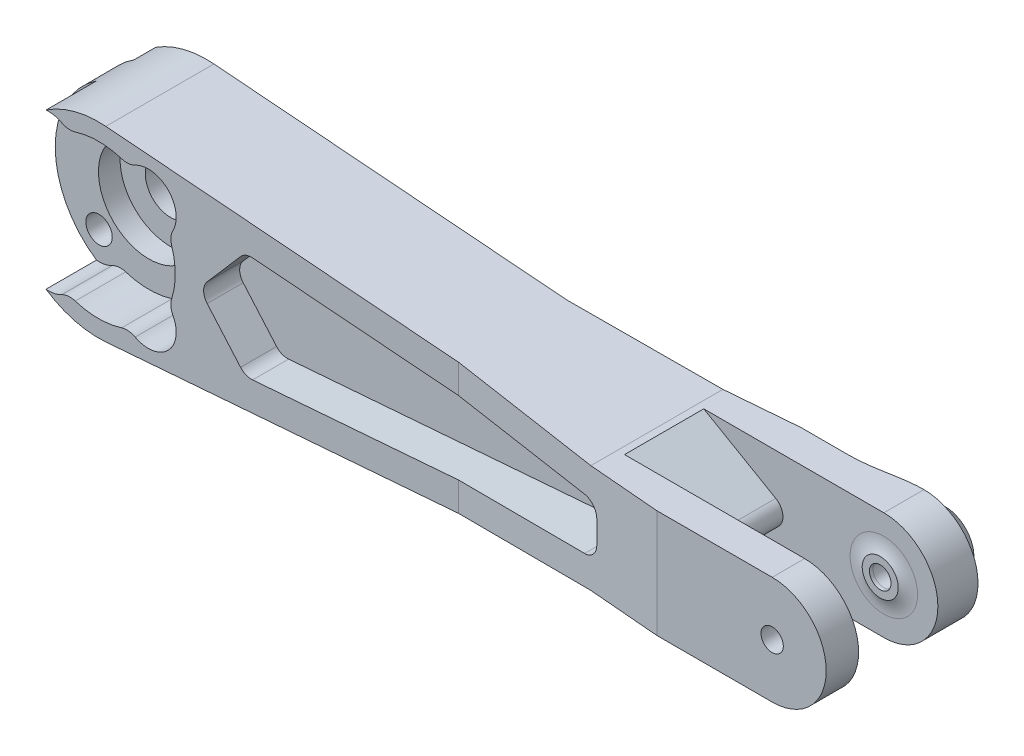
from build123d import *

# Parameters (mm, degrees)
SKETCH2_R               = 13
SKETCH2_R_2             = 7.5
BOSS_EXTRUDE2_DEPTH     = 10
CUT_EXTRUDE1_DEPTH      = 105.791459576
CUT_EXTRUDE1_DEPTH_BACK = 105.791459576
SKETCH5_R               = 1.83
SKETCH5_R_2             = 3.5
CUT_EXTRUDE2_DEPTH      = 106.770979007
HUB_CUTOUT_DEPTH        = 7
SKETCH8_R               = 7
CUT_EXTRUDE4_DEPTH      = 3
CUT_EXTRUDE5_DEPTH      = 105.791459576
CUT_EXTRUDE5_DEPTH_BACK = 105.791459576
SKETCH9_R               = 1.55
CUT_EXTRUDE6_DEPTH      = 5.5
FILLET1_R               = 2
CUT_EXTRUDE7_START      = 2.5
CUT_EXTRUDE7_DEPTH      = 103.291459576
FILLET2_R               = 2
FILLET2_OF_MIRROR1_R    = 2
SKETCH12_R              = 4
SKETCH12_R_2            = 1.55
BOSS_EXTRUDE3_DEPTH     = 4
FILLET3_START           = -14
FILLET3_2_DEPTH         = 4
BOSS_EXTRUDE4_START     = 5.5
SKETCH13_R              = 2.5
SKETCH13_R_2            = 1.5
BOSS_EXTRUDE4_DEPTH     = 0.5
BOSS_EXTRUDE5_START     = -5
SKETCH13_2_R            = 2.5
SKETCH13_2_R_2          = 1.5
BOSS_EXTRUDE5_DEPTH     = 0.5
FILLET4_R               = 5
SKETCH15_R              = 4
CUT_EXTRUDE8_DEPTH      = 3


with BuildPart() as part:
    # Sketch2 → Boss-Extrude2 (new, symmetric)
    with BuildSketch(Plane.XY):
        Circle(SKETCH2_R)
        with BuildLine():
            Line((70, 7.5), (1.025771359, 12.959467316))
            ThreePointArc((1.025771359, 12.959467316), (9.548168088, 8.822272166), (13, 0))
            ThreePointArc((13, 0), (9.548168088, -8.822272166), (1.025771359, -12.959467316))
            Line((1.025771359, -12.959467316), (70, -7.5))
            Line((70, -7.5), (70, 7.5))
        make_face()
        with BuildLine():
            Line((96, 7.5), (70, 7.5))
            Line((70, 7.5), (70, -7.5))
            Line((70, -7.5), (96, -7.5))
            ThreePointArc((96, -7.5), (88.5, 0), (96, 7.5))
        make_face()
        with Locations((96, 0)):
            Circle(SKETCH2_R_2)
        Circle(SKETCH2_R)
    extrude(amount=BOSS_EXTRUDE2_DEPTH, both=True)

    # Sketch4 → Cut-Extrude1 (cut, two sides: drawn at the far end of the back side and taken through both)
    with BuildSketch(Plane(origin=(0, 0, 0), x_dir=(1, 0, 0), z_dir=(0, 1, 0)).offset(-CUT_EXTRUDE1_DEPTH_BACK)):
        Polygon((-13, 7.5), (50, 7.5), (80, 10), (-13, 10), align=None)
        Polygon((-13, -7.5), (50, -7.5), (80, -10), (-13, -10), align=None)
    extrude(amount=CUT_EXTRUDE1_DEPTH + CUT_EXTRUDE1_DEPTH_BACK, mode=Mode.SUBTRACT)

    # Sketch5 → Cut-Extrude2 (cut, through all)
    with BuildSketch(Plane.XY.offset(7.5)):
        with Locations((-6.914797213, 6.914797213)):
            Circle(SKETCH5_R)
        with Locations((6.914797213, 6.914797213)):
            Circle(SKETCH5_R)
        with Locations((6.914797213, -6.914797213)):
            Circle(SKETCH5_R)
        with Locations((-6.914797213, -6.914797213)):
            Circle(SKETCH5_R)
        Circle(SKETCH5_R_2)
    extrude(amount=-CUT_EXTRUDE2_DEPTH, mode=Mode.SUBTRACT)

    # Sketch7 → hub cutout (cut)
    with BuildSketch(Plane.XY.offset(7.5)):
        with BuildLine():
            ThreePointArc((-7.281143007, 10.769631215), (-13, 0), (-7.281143007, -10.769631215))
            ThreePointArc((-7.281143007, -10.769631215), (-6.15529138, -10.711783559), (-5.093815501, -10.332103173))
            ThreePointArc((-5.093815501, -10.332103173), (-4.17580433, -10.057753531), (-3.223255475, -10.161014917))
            ThreePointArc((-3.223255475, -10.161014917), (0, -10.66), (3.223255475, -10.161014917))
            ThreePointArc((3.223255475, -10.161014917), (4.17580433, -10.057753531), (5.093815501, -10.332103173))
            ThreePointArc((5.093815501, -10.332103173), (9.652858062, -9.652858062), (10.332103173, -5.093815501))
            ThreePointArc((10.332103173, -5.093815501), (10.057753531, -4.17580433), (10.161014917, -3.223255475))
            ThreePointArc((10.161014917, -3.223255475), (10.66, 0), (10.161014917, 3.223255475))
            ThreePointArc((10.161014917, 3.223255475), (10.057753531, 4.17580433), (10.332103173, 5.093815501))
            ThreePointArc((10.332103173, 5.093815501), (9.652858062, 9.652858062), (5.093815501, 10.332103173))
            ThreePointArc((5.093815501, 10.332103173), (4.17580433, 10.057753531), (3.223255475, 10.161014917))
            ThreePointArc((3.223255475, 10.161014917), (0, 10.66), (-3.223255475, 10.161014917))
            ThreePointArc((-3.223255475, 10.161014917), (-4.17580433, 10.057753531), (-5.093815501, 10.332103173))
            ThreePointArc((-5.093815501, 10.332103173), (-6.15529138, 10.711783559), (-7.281143007, 10.769631215))
        make_face()
    extrude(amount=-HUB_CUTOUT_DEPTH, mode=Mode.SUBTRACT)

    # Sketch8 → Cut-Extrude4 (cut)
    with BuildSketch(Plane.XY.offset(0.5)):
        Circle(SKETCH8_R)
    extrude(amount=-CUT_EXTRUDE4_DEPTH, mode=Mode.SUBTRACT)

    # Sketch9 → Cut-Extrude5 (cut, two sides: drawn at the far end of the back side and taken through both)
    with BuildSketch(Plane.XY.offset(-CUT_EXTRUDE5_DEPTH_BACK)):
        with Locations((96, 0)):
            Circle(SKETCH9_R)
    extrude(amount=CUT_EXTRUDE5_DEPTH + CUT_EXTRUDE5_DEPTH_BACK, mode=Mode.SUBTRACT)

    # Sketch10 → Cut-Extrude6 (cut, symmetric)
    with BuildSketch(Plane.XY):
        Polygon((84, 0), (62.184725581, 12.595054558), (110.068063566, 12.595054558), (110.068063566, -12.520209035), (62.31436183, -12.520209035), align=None)
    extrude(amount=CUT_EXTRUDE6_DEPTH, both=True, mode=Mode.SUBTRACT)

    # Fillet1
    fillet1_edges = [part.edges().sort_by_distance(p)[0] for p in [
        (84, 0, 0),
    ]]
    fillet(fillet1_edges, radius=FILLET1_R)

    # Sketch11 → Cut-Extrude7 (cut, through all)
    with BuildSketch(Plane.XY.offset(CUT_EXTRUDE7_START)):
        Polygon((13.951045221, 0), (20.381756661, 7.414886386), (70.904413477, 3.415903011), (70.904413477, 0), (70.904413477, -3.415903011), (20.381756661, -7.414886386), align=None)
    cut_extrude7 = extrude(amount=CUT_EXTRUDE7_DEPTH, mode=Mode.SUBTRACT)

    # Fillet2
    fillet2_edges = [part.edges().sort_by_distance(p)[0] for p in [
        (13.951045221, 0, 5),
        (20.381756661, 7.414886386, 5),
        (20.381756661, -7.414886386, 5),
        (70.904413477, -3.415903011, 5.871017228),
        (70.904413477, 3.415903011, 5.871017228),
    ]]
    fillet(fillet2_edges, radius=FILLET2_R)

    # Mirror1: Cut-Extrude7 across plane
    add(cut_extrude7.mirror(Plane.XY), mode=Mode.SUBTRACT)

    # Fillet2 of Mirror1
    fillet2_of_mirror1_edges = [part.edges().sort_by_distance(p)[0] for p in [
        (13.951045221, 0, -5),
        (20.381756661, 7.414886386, -5),
        (20.381756661, -7.414886386, -5),
        (70.904413477, -3.415903011, -5.871017228),
        (70.904413477, 3.415903011, -5.871017228),
    ]]
    fillet(fillet2_of_mirror1_edges, radius=FILLET2_OF_MIRROR1_R)

    # Sketch12 → Boss-Extrude3 (add)
    with BuildSketch(Plane(origin=(0, 0, -10), x_dir=(-1, 0, 0), z_dir=(0, 0, -1))):
        with Locations(Location((-96, 0, 0), (0, 0, 180))):
            Circle(SKETCH12_R)
        with Locations(Location((-96, 0, 0), (0, 0, 180))):
            Circle(SKETCH12_R_2, mode=Mode.SUBTRACT)
    extrude(amount=BOSS_EXTRUDE3_DEPTH)

    # Fillet3: read off the stored shape, not the designer's step
    # Fillet3 outline → Fillet3 (revolve)
    with BuildSketch(Plane(origin=(96, 0, 0), x_dir=(1, 0, 0), z_dir=(0, -1, 0))):
        with BuildLine():
            ThreePointArc((4, -14), (7.527864045, -11.05572809), (12, -10))
            Line((12, -10), (4, -10))
            Line((4, -10), (4, -14))
        make_face()
    revolve(axis=Axis((96, 0, 0), (0, 0, 1)))

    # Fillet3 2 outline → Fillet3 2 (cut)
    with BuildSketch(Plane.XY.offset(FILLET3_START)):
        with BuildLine():
            ThreePointArc((96, 7.5), (103.5, 0), (96, -7.5))
            Line((96, -7.5), (85, -7.5))
            Line((85, -7.5), (85, -13))
            Line((85, -13), (109, -13))
            Line((109, -13), (109, 13))
            Line((109, 13), (85, 13))
            Line((85, 13), (85, 7.5))
            Line((85, 7.5), (96, 7.5))
        make_face()
    extrude(amount=FILLET3_2_DEPTH, mode=Mode.SUBTRACT)

    # Sketch13 → Boss-Extrude4 (add)
    with BuildSketch(Plane.XY.offset(BOSS_EXTRUDE4_START)):
        with Locations((96, 0)):
            Circle(SKETCH13_R)
        with Locations((96, 0)):
            Circle(SKETCH13_R_2, mode=Mode.SUBTRACT)
    extrude(amount=-BOSS_EXTRUDE4_DEPTH)

    # Sketch13<2> → Boss-Extrude5 (add)
    with BuildSketch(Plane.XY.offset(BOSS_EXTRUDE5_START)):
        with Locations((96, 0)):
            Circle(SKETCH13_2_R)
        with Locations((96, 0)):
            Circle(SKETCH13_2_R_2, mode=Mode.SUBTRACT)
    extrude(amount=-BOSS_EXTRUDE5_DEPTH)

    # Fillet4
    # the kernel refuses this fillet: 5 mm, written as the material it adds along each edge
    with BuildSketch(Plane(origin=(96, 0, 5.5), x_dir=(1, 0, 0), z_dir=(0, -1, 0))) as fillet4_piece_1:
        with BuildLine():
            CenterArc((4.679449472, -5), FILLET4_R, 90, 25.841932763)
            Line((2.5, -0.5), (2.456411011, -0.41))
            ThreePointArc((2.456411011, -0.41), (2.4, -0.25), (2.4, 0))
            Line((2.4, 0), (2.5, 0.1))
            Line((2.5, 0.1), (4.679449472, 0.1))
            Line((4.679449472, 0.1), (4.679449472, 0))
        make_face()
    revolve(axis=Axis((96, 0, 5.5), (0, 0, 1)))
    with BuildSketch(Plane(origin=(96, 0, -5.5), x_dir=(1, 0, 0), z_dir=(0, -1, 0))) as fillet4_piece_2:
        with BuildLine():
            CenterArc((4.679449472, 5), FILLET4_R, 244.158067237, 25.841932763)
            Line((2.5, 0.5), (2.456411011, 0.41))
            ThreePointArc((2.456411011, 0.41), (2.4, 0.25), (2.4, 0))
            Line((2.4, 0), (2.5, -0.1))
            Line((2.5, -0.1), (4.679449472, -0.1))
            Line((4.679449472, -0.1), (4.679449472, 0))
        make_face()
    revolve(axis=Axis((96, 0, -5.5), (0, 0, 1)))

    # Sketch15 → Cut-Extrude8 (cut)
    with BuildSketch(Plane(origin=(0, 0, -7.5), x_dir=(-1, 0, 0), z_dir=(0, 0, -1))):
        with Locations((6.914797213, -6.914797213)):
            Circle(SKETCH15_R)
        with Locations((-6.914797213, -6.914797213)):
            Circle(SKETCH15_R)
        with Locations((6.914797213, 6.914797213)):
            Circle(SKETCH15_R)
        with Locations((-6.914797213, 6.914797213)):
            Circle(SKETCH15_R)
    extrude(amount=-CUT_EXTRUDE8_DEPTH, mode=Mode.SUBTRACT)


solid = part.part
